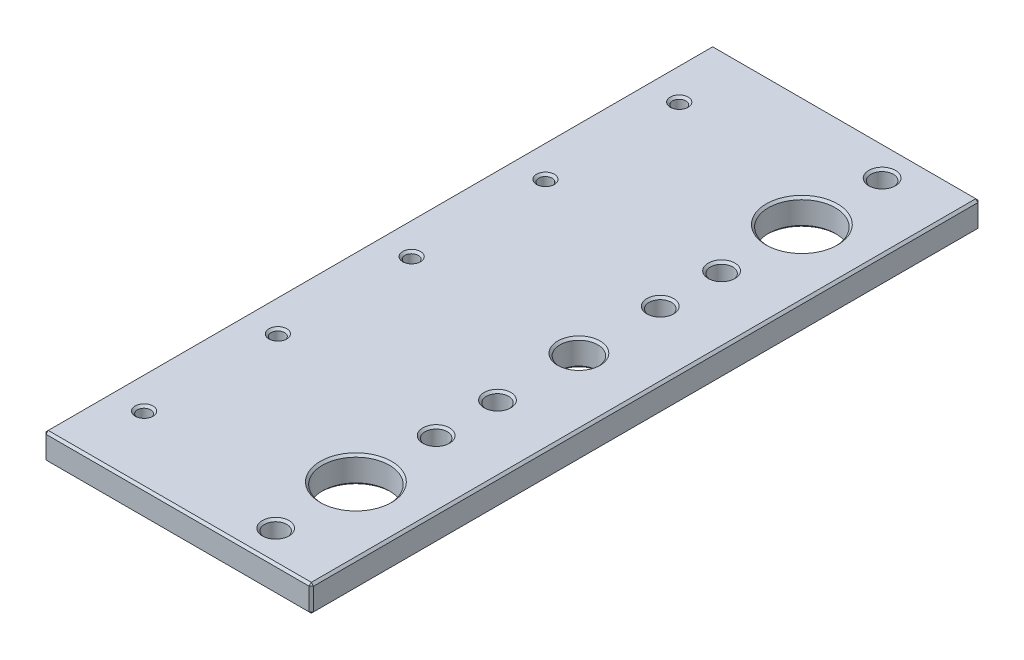
from build123d import *

# Parameters (mm, degrees)
CROQUIS1_W              = 60
CROQUIS1_H              = 150
CROQUIS1_R              = 1.5
CROQUIS1_R_2            = 2.5
CROQUIS1_R_3            = 4.25
CROQUIS1_R_4            = 7.5
SALIENTE_EXTRUIR1_DEPTH = 6
CHAFL_N1_SIZE           = 0.5


with BuildPart() as part:
    # Croquis1 → Saliente-Extruir1 (new body)
    with BuildSketch(Plane(origin=(0, 0, 0), x_dir=(1, 0, 0), z_dir=(0, 1, 0))):
        with Locations((-9.728313692, -1.041413592)):
            Rectangle(CROQUIS1_W, CROQUIS1_H)
        with Locations((-32.228313692, 28.958586408)):
            Circle(CROQUIS1_R, mode=Mode.SUBTRACT)
        with Locations((-32.228313692, -31.041413592)):
            Circle(CROQUIS1_R, mode=Mode.SUBTRACT)
        with Locations((5.271686308, 17.208586408)):
            Circle(CROQUIS1_R_2, mode=Mode.SUBTRACT)
        with Locations((5.271686308, -19.291413592)):
            Circle(CROQUIS1_R_2, mode=Mode.SUBTRACT)
        with Locations((-32.228313692, 58.958586408)):
            Circle(CROQUIS1_R, mode=Mode.SUBTRACT)
        with Locations((-32.228313692, -61.041413592)):
            Circle(CROQUIS1_R, mode=Mode.SUBTRACT)
        with Locations((5.271686308, -1.041413592)):
            Circle(CROQUIS1_R_3, mode=Mode.SUBTRACT)
        with Locations((-32.228313692, -1.041413592)):
            Circle(CROQUIS1_R, mode=Mode.SUBTRACT)
        with Locations((5.271686308, -51.041413592)):
            Circle(CROQUIS1_R_4, mode=Mode.SUBTRACT)
        with Locations((5.271686308, 48.958586408)):
            Circle(CROQUIS1_R_4, mode=Mode.SUBTRACT)
        with Locations((5.271686308, 66.958586408)):
            Circle(CROQUIS1_R_2, mode=Mode.SUBTRACT)
        with Locations((5.271686308, 30.958586408)):
            Circle(CROQUIS1_R_2, mode=Mode.SUBTRACT)
        with Locations((5.271686308, -33.041413592)):
            Circle(CROQUIS1_R_2, mode=Mode.SUBTRACT)
        with Locations((5.271686308, -69.041413592)):
            Circle(CROQUIS1_R_2, mode=Mode.SUBTRACT)
    extrude(amount=SALIENTE_EXTRUIR1_DEPTH)

    # Chaflán1
    chafl_n1_edges = [part.edges().sort_by_distance(p)[0] for p in [
        (-39.728313692, 3, -73.958586408),
        (-39.728313692, 3, 76.041413592),
        (20.271686308, 3, 76.041413592),
        (-9.728313692, 0, 76.041413592),
        (20.271686308, 0, 1.041413592),
        (-39.728313692, 0, 1.041413592),
        (-9.728313692, 0, -73.958586408),
        (20.271686308, 3, -73.958586408),
        (-9.728313692, 6, -73.958586408),
        (20.271686308, 6, 1.041413592),
        (-9.728313692, 6, 76.041413592),
        (-39.728313692, 6, 1.041413592),
        (-33.728313692, 0, 61.041413592),
        (-33.728313692, 0, -58.958586408),
        (-33.728313692, 6, 61.041413592),
        (-33.728313692, 6, -58.958586408),
        (1.021686308, 0, 1.041413592),
        (1.021686308, 6, 1.041413592),
        (-2.228313692, 0, -48.958586408),
        (-33.728313692, 0, 1.041413592),
        (-2.228313692, 0, 51.041413592),
        (-2.228313692, 6, -48.958586408),
        (-33.728313692, 6, 1.041413592),
        (-2.228313692, 6, 51.041413592),
        (2.771686308, 0, 69.041413592),
        (2.771686308, 0, -30.958586408),
        (2.771686308, 0, -66.958586408),
        (2.771686308, 0, 33.041413592),
        (2.771686308, 6, 69.041413592),
        (2.771686308, 6, -30.958586408),
        (2.771686308, 6, -66.958586408),
        (2.771686308, 6, 33.041413592),
        (-33.728313692, 0, 31.041413592),
        (-33.728313692, 0, -28.958586408),
        (-33.728313692, 6, 31.041413592),
        (-33.728313692, 6, -28.958586408),
        (2.771686308, 0, 19.291413592),
        (2.771686308, 0, -17.208586408),
        (2.771686308, 6, 19.291413592),
        (2.771686308, 6, -17.208586408),
    ]]
    chamfer(chafl_n1_edges, length=CHAFL_N1_SIZE)


solid = part.part
